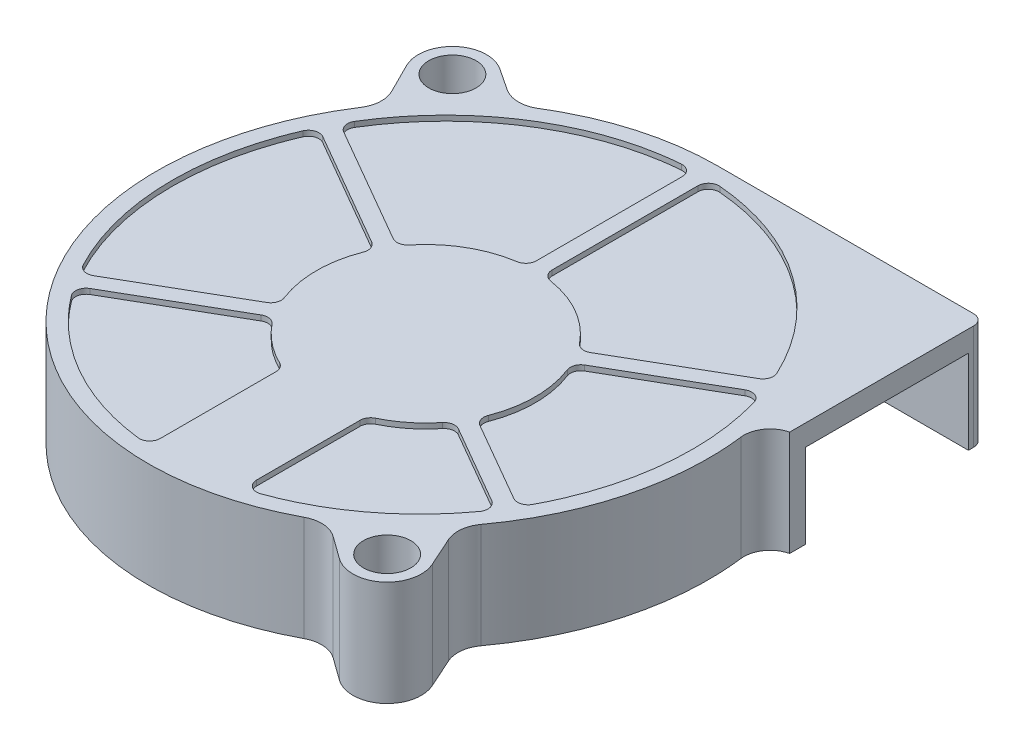
from build123d import *

# Parameters (mm, degrees)
SKETCH18_R          = 2.25
BOSS_EXTRUDE3_DEPTH = 2
CUT_EXTRUDE9_DEPTH  = 0.5
FILLET4_R           = 2.5
BOSS_EXTRUDE4_START = -8
SKETCH22_R          = 2.25
BOSS_EXTRUDE4_DEPTH = 8


with BuildPart() as part:
    # Sketch18 → Boss-Extrude3 (new body)
    with BuildSketch(Plane(origin=(0, 0, 0), x_dir=(1, 0, 0), z_dir=(0, 1, 0))):
        with BuildLine():
            Line((-23.005700489, 21.173936517), (-21.582450949, 18.333239239))
            ThreePointArc((-21.582450949, 18.333239239), (-21.290226852, 16.922030245), (-21.738588357, 15.552403394))
            add(Edge.make_bspline(
                [(-21.738588357, 15.552403394), (-74.642199686, -65.790312539), (9.324862756, -20.895925284)],
                knots=[4.619035423, 4.619035423, 4.619035423, 7.234825226, 7.234825226, 7.234825226], degree=2, weights=[1, 0.259883374, 1]))
            ThreePointArc((9.324862756, -20.895925284), (10.831803609, -20.571378647), (12.282148638, -21.093586031))
            Line((12.282148638, -21.093586031), (14.423232763, -22.636631148))
            ThreePointArc((14.423232763, -22.636631148), (18.378398581, -22.5178413), (19.287328639, -18.666699414))
            Line((19.287328639, -18.666699414), (18.031066286, -15.874036932))
            ThreePointArc((18.031066286, -15.874036932), (17.800260945, -14.429576005), (18.329372436, -13.065838675))
            add(Edge.make_bspline(
                [(18.329372436, -13.065838675), (25.853819451, -2.840337036), (23.001584271, 9.2)],
                knots=[1.416240338, 1.416240338, 1.416240338, 2.32192048, 2.32192048, 2.32192048], degree=2, weights=[1, 0.89920814, 1]))
            Line((23.001584271, 9.2), (25.4, 9.2))
            Line((25.4, 9.2), (25.4, 26.7))
            ThreePointArc((25.4, 26.7), (25.107106781, 27.407106781), (24.4, 27.7))
            Line((24.4, 27.7), (-0.010581904, 27.7))
            add(Edge.make_bspline(
                [(-0.010581904, 27.7), (-7.028971285, 27.7), (-13.197915422, 23.907683644)],
                knots=[3.605852843, 3.605852843, 3.605852843, 4.154921422, 4.154921422, 4.154921422], degree=2, weights=[1, 0.962551555, 1]))
            ThreePointArc((-13.197915422, 23.907683644), (-14.708437667, 23.493357847), (-16.205141277, 23.955117118))
            Line((-16.205141277, 23.955117118), (-18.311498324, 25.343379249))
            ThreePointArc((-18.311498324, 25.343379249), (-22.258262373, 25.059651887), (-23.005700489, 21.173936517))
        make_face()
        with Locations(Location((16.3234107, -20, 0), (0, 0, 270))):
            Circle(SKETCH18_R, mode=Mode.SUBTRACT)
        with Locations(Location((-20.1, 22.629754043, 0), (0, 0, 270))):
            Circle(SKETCH18_R, mode=Mode.SUBTRACT)
    extrude(amount=BOSS_EXTRUDE3_DEPTH)

    # Sketch21 → Cut-Extrude9 (cut)
    with BuildSketch(Plane.XZ.offset(-2)):
        with BuildLine():
            Line((9.380671427, 6.281958578), (16.889664258, 10.61727761))
            ThreePointArc((16.889664258, 10.61727761), (17.367921917, 11.27590978), (17.198057734, 12.071945509))
            add(Edge.make_bspline(
                [(17.198057734, 12.071945509), (12.554899126, 18.448479912), (5.336676879, 21.029359579)],
                knots=[1.72060662, 1.72060662, 1.72060662, 2.341313714, 2.341313714, 2.341313714], degree=2, weights=[1, 0.952225658, 1]))
            ThreePointArc((5.336676879, 21.029359579), (4.424099348, 20.905259025), (4, 20.087739337))
            Line((4, 20.087739337), (4, 10.24499878))
            ThreePointArc((4, 10.24499878), (4.151885476, 9.715185837), (4.561403509, 9.346314676))
            ThreePointArc((4.561403509, 9.346314676), (6.487216138, 8.128716183), (8.101665162, 6.520967843))
            ThreePointArc((8.101665162, 6.520967843), (8.696980161, 6.164999994), (9.380671427, 6.281958578))
        make_face()
        with BuildLine():
            Line((10.130671427, 4.982920472), (17.749498035, 9.381652065))
            ThreePointArc((17.749498035, 9.381652065), (18.524335906, 9.477117246), (19.131663578, 8.9865661))
            add(Edge.make_bspline(
                [(21.249872044, -9.970202217), (24.056123087, -0.237950121), (19.131663578, 8.9865661)],
                knots=[0.769514416, 0.769514416, 0.769514416, 1.572568981, 1.572568981, 1.572568981], degree=2, weights=[1, 0.920465168, 1]))
            ThreePointArc((21.249872044, -9.970202217), (20.662940109, -10.620604923), (19.789018765, -10.559169907))
            Line((19.789018765, -10.559169907), (10.130671427, -4.982920472))
            ThreePointArc((10.130671427, -4.982920472), (9.68753669, -4.449305759), (9.69815639, -3.755763922))
            ThreePointArc((9.69815639, -3.755763922), (10.4, 0), (9.69815639, 3.755763922))
            ThreePointArc((9.69815639, 3.755763922), (9.68753669, 4.449305759), (10.130671427, 4.982920472))
        make_face()
        with BuildLine():
            Line((-10.130671427, -4.982920472), (-21.139286828, -11.338747537))
            ThreePointArc((-21.139286828, -11.338747537), (-21.9528823, -11.422278809), (-22.556709037, -10.870637315))
            add(Edge.make_bspline(
                [(-21.961052126, 10.614886102), (-27.404440798, 0.306158598), (-22.556709037, -10.870637315)],
                knots=[3.708622327, 3.708622327, 3.708622327, 4.627736191, 4.627736191, 4.627736191], degree=2, weights=[1, 0.896249109, 1]))
            ThreePointArc((-21.961052126, 10.614886102), (-21.353777236, 11.108813785), (-20.576761985, 11.013973667))
            Line((-20.576761985, 11.013973667), (-10.130671427, 4.982920472))
            ThreePointArc((-10.130671427, 4.982920472), (-9.68753669, 4.449305759), (-9.69815639, 3.755763922))
            ThreePointArc((-9.69815639, 3.755763922), (-10.4, 0), (-9.69815639, -3.755763922))
            ThreePointArc((-9.69815639, -3.755763922), (-9.68753669, -4.449305759), (-10.130671427, -4.982920472))
        make_face()
        with BuildLine():
            Line((9.380671427, -6.281958578), (19.541752537, -12.148461491))
            ThreePointArc((19.541752537, -12.148461491), (19.995803, -12.714840914), (19.947118982, -13.43911803))
            add(Edge.make_bspline(
                [(1.832210196, -26.124693311), (14.486982659, -25.080808446), (19.947118982, -13.43911803)],
                knots=[5.899428803, 5.899428803, 5.899428803, 6.896434086, 6.896434086, 6.896434086], degree=2, weights=[1, 0.87829945, 1]))
            ThreePointArc((1.832210196, -26.124693311), (1.072582181, -25.86367676), (0.75, -25.128078298))
            Line((0.75, -25.128078298), (0.75, -11.26487905))
            ThreePointArc((0.75, -11.26487905), (0.990556529, -10.614305753), (1.596491228, -10.276731764))
            ThreePointArc((1.596491228, -10.276731764), (5.2, -9.006664199), (8.101665162, -6.520967843))
            ThreePointArc((8.101665162, -6.520967843), (8.696980161, -6.164999994), (9.380671427, -6.281958578))
        make_face()
        with BuildLine():
            Line((-4, 10.24499878), (-4, 21.25280893))
            ThreePointArc((-4, 21.25280893), (-4.335734031, 22.000305233), (-5.117501446, 22.245881642))
            add(Edge.make_bspline(
                [(-5.117501446, 22.245881642), (-14.362152408, 21.152044459), (-19.994447245, 13.707442628)],
                knots=[2.791698852, 2.791698852, 2.791698852, 3.552181829, 3.552181829, 3.552181829], degree=2, weights=[1, 0.928575035, 1]))
            ThreePointArc((-19.994447245, 13.707442628), (-20.177080874, 12.905669736), (-19.696965717, 12.238073863))
            Line((-19.696965717, 12.238073863), (-9.380671427, 6.281958578))
            ThreePointArc((-9.380671427, 6.281958578), (-8.696980161, 6.164999994), (-8.101665162, 6.520967843))
            ThreePointArc((-8.101665162, 6.520967843), (-6.487216138, 8.128716183), (-4.561403509, 9.346314676))
            ThreePointArc((-4.561403509, 9.346314676), (-4.151885476, 9.715185837), (-4, 10.24499878))
        make_face()
        with BuildLine():
            Line((-9.380671427, -6.281958578), (-20.52543024, -12.716388078))
            ThreePointArc((-20.52543024, -12.716388078), (-20.994462803, -13.335480514), (-20.878910009, -14.103539458))
            add(Edge.make_bspline(
                [(-20.878910009, -14.103539458), (-14.140957085, -25.138695581), (-1.830055545, -26.127424933)],
                knots=[4.775770168, 4.775770168, 4.775770168, 5.742874897, 5.742874897, 5.742874897], degree=2, weights=[1, 0.885348922, 1]))
            ThreePointArc((-1.830055545, -26.127424933), (-1.071787476, -25.865500348), (-0.75, -25.130634529))
            Line((-0.75, -25.130634529), (-0.75, -11.26487905))
            ThreePointArc((-0.75, -11.26487905), (-0.990556529, -10.614305753), (-1.596491228, -10.276731764))
            ThreePointArc((-1.596491228, -10.276731764), (-5.2, -9.006664199), (-8.101665162, -6.520967843))
            ThreePointArc((-8.101665162, -6.520967843), (-8.696980161, -6.164999994), (-9.380671427, -6.281958578))
        make_face()
    extrude(amount=CUT_EXTRUDE9_DEPTH, mode=Mode.SUBTRACT)

    # Fillet4
    # the kernel refuses this fillet: 2.5 mm, written as the material it adds along each edge
    with BuildSketch(Plane(origin=(23.001584271, 0, -9.2), x_dir=(0.17749566979778525, 0, 0.984121581514721), z_dir=(0, 1, 0))) as fillet4_piece_1:
        with BuildLine():
            CenterArc((2.92200386, 2.496380503), FILLET4_R, 183.119527415, 83.796971124)
            Line((0.425708406, 2.360332681), (0.375782497, 2.357611724))
            ThreePointArc((0.375782497, 2.357611724), (0.163648124, 1.189041124), (-0.049206079, 0.008874783))
            Line((-0.049206079, 0.008874783), (0.002706733, -0.049926682))
            ThreePointArc((0.002706733, -0.049926682), (1.393761766, -0.012367951), (2.7848361, -0.04992761))
            Line((2.7848361, -0.04992761), (2.787525664, 0))
        make_face()
    extrude(amount=2)

    # Sketch22 → Boss-Extrude4 (add)
    with BuildSketch(Plane(origin=(0, 0, 0), x_dir=(1, 0, 0), z_dir=(0, 1, 0)).offset(BOSS_EXTRUDE4_START)):
        with BuildLine():
            Line((25.4, 26.2), (0.134529672, 26.2))
            add(Edge.make_bspline(
                [(0.134529672, 26.2), (-65.215610903, 26.624283577), (-17.183732342, -16.776374937), (30.848146218, -60.177033451), (21.98456834, 6.456735835)],
                knots=[0.456497732, 0.456497732, 0.456497732, 2.910135969, 2.910135969, 5.363774207, 5.363774207, 5.363774207], degree=2, weights=[1, 0.337233976, 1, 0.337233976, 1]))
            ThreePointArc((21.98456834, 6.456735835), (22.848811029, 9.267581485), (25.4, 10.730183114))
            Line((25.4, 10.730183114), (25.4, 9.2))
            ThreePointArc((25.4, 9.2), (23.923052453, 8.192770648), (23.496358005, 6.456735835))
            add(Edge.make_bspline(
                [(18.329372436, -13.065838675), (24.834553394, -4.225489554), (23.496358005, 6.456735835)],
                knots=[1.416240338, 1.416240338, 1.416240338, 2.212605547, 2.212605547, 2.212605547], degree=2, weights=[1, 0.9217672, 1]))
            ThreePointArc((18.329372436, -13.065838675), (17.800260945, -14.429576005), (18.031066286, -15.874036932))
            Line((18.031066286, -15.874036932), (19.287328639, -18.666699414))
            ThreePointArc((19.287328639, -18.666699414), (18.378398581, -22.5178413), (14.423232763, -22.636631148))
            Line((14.423232763, -22.636631148), (12.282148638, -21.093586031))
            ThreePointArc((12.282148638, -21.093586031), (10.831803609, -20.571378647), (9.324862756, -20.895925284))
            add(Edge.make_bspline(
                [(-21.738588357, 15.552403394), (-74.642199686, -65.790312539), (9.324862756, -20.895925284)],
                knots=[4.619035423, 4.619035423, 4.619035423, 7.234825226, 7.234825226, 7.234825226], degree=2, weights=[1, 0.259883374, 1]))
            ThreePointArc((-21.738588357, 15.552403394), (-21.290226852, 16.922030245), (-21.582450949, 18.333239239))
            Line((-21.582450949, 18.333239239), (-23.005700489, 21.173936517))
            ThreePointArc((-23.005700489, 21.173936517), (-22.258262373, 25.059651887), (-18.311498324, 25.343379249))
            Line((-18.311498324, 25.343379249), (-16.205141277, 23.955117118))
            ThreePointArc((-16.205141277, 23.955117118), (-14.708437667, 23.493357847), (-13.197915422, 23.907683644))
            add(Edge.make_bspline(
                [(-0.010581904, 27.7), (-7.028971285, 27.7), (-13.197915422, 23.907683644)],
                knots=[3.605852843, 3.605852843, 3.605852843, 4.154921422, 4.154921422, 4.154921422], degree=2, weights=[1, 0.962551555, 1]))
            Line((-0.010581904, 27.7), (24.4, 27.7))
            ThreePointArc((24.4, 27.7), (25.107106781, 27.407106781), (25.4, 26.7))
            Line((25.4, 26.7), (25.4, 26.2))
        make_face()
        with Locations(Location((16.3234107, -20, 0), (0, 0, 270))):
            Circle(SKETCH22_R, mode=Mode.SUBTRACT)
        with Locations(Location((-20.1, 22.629754043, 0), (0, 0, 270))):
            Circle(SKETCH22_R, mode=Mode.SUBTRACT)
    extrude(amount=BOSS_EXTRUDE4_DEPTH)


solid = part.part
